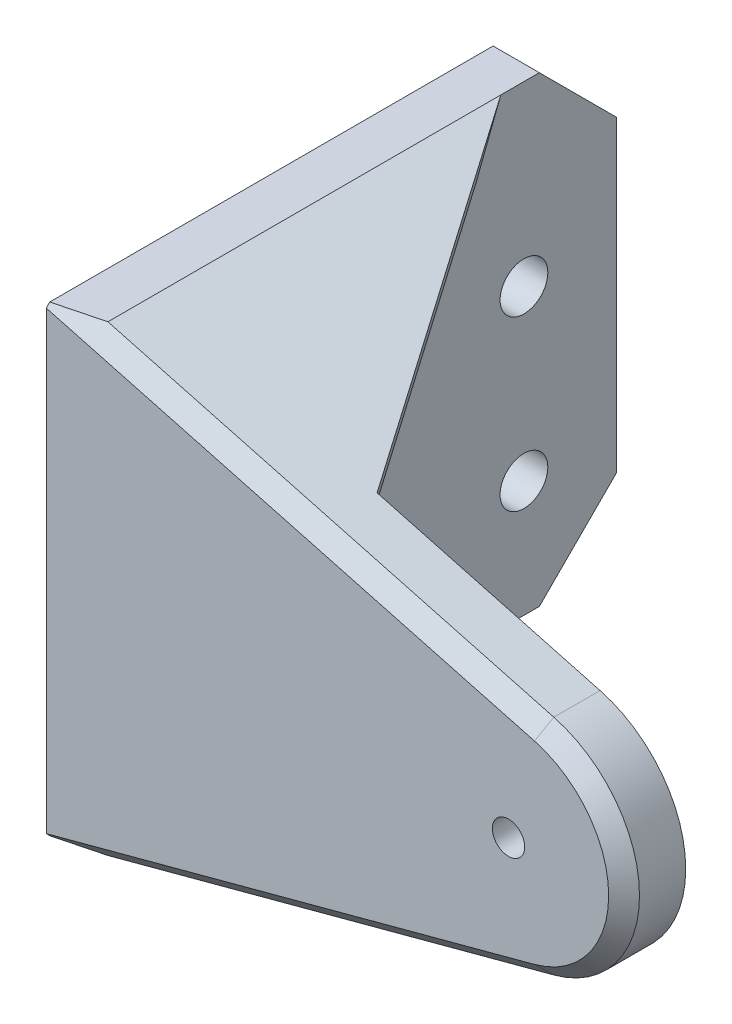
from build123d import *

# Parameters (mm, degrees)
BOSS_EXTRUDE1_DEPTH = 4
SKETCH1_3_R         = 1.984
CUT_EXTRUDE1_DEPTH  = 1
CUT_EXTRUDE2_REACH  = 34.188
SKETCH2_R           = 1.05
SKETCH3_W           = 3
SKETCH3_H           = 30
BOSS_EXTRUDE2_DEPTH = 30
BOSS_EXTRUDE3_DEPTH = 4
CHAMFER1_SIZE       = 5
CHAMFER2_SIZE       = 5
CHAMFER3_SIZE       = 1
CUT_EXTRUDE3_REACH  = 52.128
SKETCH6_R           = 1.55


with BuildPart() as part:
    # Sketch1 → Boss-Extrude1 (new body)
    with BuildSketch(Plane.XY):
        with BuildLine():
            Line((-21.444, -9.44375), (7.49732978, -1.688143604))
            ThreePointArc((7.49732978, -1.688143604), (13.056, 5.55625), (7.49732978, 12.800643604))
            Line((7.49732978, 12.800643604), (-21.444, 20.55625))
            Line((-21.444, 20.55625), (-24.444, 20.55625))
            Line((-24.444, 20.55625), (-24.444, -9.44375))
            Line((-24.444, -9.44375), (-21.444, -9.44375))
        make_face()
    extrude(amount=BOSS_EXTRUDE1_DEPTH)

    # Sketch1<3> → Cut-Extrude1 (cut)
    with BuildSketch(Plane.XY):
        with Locations((5.556, 5.55625)):
            Circle(SKETCH1_3_R)
    extrude(amount=CUT_EXTRUDE1_DEPTH, mode=Mode.SUBTRACT)

    # Sketch2 → Cut-Extrude2 (cut, up to next)
    with BuildSketch(Plane.XY.offset(4), mode=Mode.PRIVATE) as cut_extrude2_sk1:
        with Locations((5.556, 5.55625)):
            Circle(SKETCH2_R)
    cut_extrude2_tool1 = extrude(cut_extrude2_sk1.sketch, amount=-CUT_EXTRUDE2_REACH, mode=Mode.PRIVATE) & part.part
    add(cut_extrude2_tool1.solids().sort_by_distance((5.556, 5.55625, 4))[0], mode=Mode.SUBTRACT)

    # Sketch3 → Boss-Extrude2 (add)
    with BuildSketch(Plane(origin=(0, 0, 0), x_dir=(-1, 0, 0), z_dir=(0, 0, -1))):
        with Locations((22.944, 5.55625)):
            Rectangle(SKETCH3_W, SKETCH3_H)
    extrude(amount=BOSS_EXTRUDE2_DEPTH)

    # Sketch4 → Boss-Extrude3 (add)
    with BuildSketch(Plane(origin=(3.702769565, 13.817497898, 0), x_dir=(0.9659191471648285, -0.25884397064712666, 0), z_dir=(0.25884397064712666, 0.9659191471648285, 0))):
        Polygon((-26.034031563, 22.5), (-11.052793297, 0), (-11.052793297, -0.5), (-26.034031563, -0.5), align=None)
    extrude(amount=-BOSS_EXTRUDE3_DEPTH)

    # Chamfer1
    chamfer1_edges = [part.edges().sort_by_distance(p)[0] for p in [
        (-21.444, 3.485683322, 0),
    ]]
    chamfer(chamfer1_edges, length=CHAMFER1_SIZE)

    # Chamfer2
    chamfer2_edges = [part.edges().sort_by_distance(p)[0] for p in [
        (-22.944, -9.44375, -30),
        (-22.944, 20.55625, -30),
    ]]
    chamfer(chamfer2_edges, length=CHAMFER2_SIZE)

    # Chamfer3
    chamfer3_edges = [part.edges().sort_by_distance(p)[0] for p in [
        (-6.97333511, -5.565946802, 4),
        (13.056, 5.55625, 4),
        (-6.97333511, 16.678446802, 4),
    ]]
    chamfer(chamfer3_edges, length=CHAMFER3_SIZE)

    # Sketch6 → Cut-Extrude3 (cut, up to next)
    with BuildSketch(Plane(origin=(-21.444, 0, 0), x_dir=(0, 0, -1), z_dir=(1, 0, 0)), mode=Mode.PRIVATE) as cut_extrude3_sk1:
        with Locations((11, 9.04722098)):
            Circle(SKETCH6_R)
    cut_extrude3_tool1 = extrude(cut_extrude3_sk1.sketch, amount=-CUT_EXTRUDE3_REACH, mode=Mode.PRIVATE) & part.part
    # Sketch6 → Cut-Extrude3 (cut, up to next)
    with BuildSketch(Plane(origin=(-21.444, 0, 0), x_dir=(0, 0, -1), z_dir=(1, 0, 0)), mode=Mode.PRIVATE) as cut_extrude3_sk2:
        with Locations((24, 9.04722098)):
            Circle(SKETCH6_R)
    cut_extrude3_tool2 = extrude(cut_extrude3_sk2.sketch, amount=-CUT_EXTRUDE3_REACH, mode=Mode.PRIVATE) & part.part
    # Sketch6 → Cut-Extrude3 (cut, up to next)
    with BuildSketch(Plane(origin=(-21.444, 0, 0), x_dir=(0, 0, -1), z_dir=(1, 0, 0)), mode=Mode.PRIVATE) as cut_extrude3_sk3:
        with Locations((11, -1.889802378)):
            Circle(SKETCH6_R)
    cut_extrude3_tool3 = extrude(cut_extrude3_sk3.sketch, amount=-CUT_EXTRUDE3_REACH, mode=Mode.PRIVATE) & part.part
    # Sketch6 → Cut-Extrude3 (cut, up to next)
    with BuildSketch(Plane(origin=(-21.444, 0, 0), x_dir=(0, 0, -1), z_dir=(1, 0, 0)), mode=Mode.PRIVATE) as cut_extrude3_sk4:
        with Locations((24, -1.889802378)):
            Circle(SKETCH6_R)
    cut_extrude3_tool4 = extrude(cut_extrude3_sk4.sketch, amount=-CUT_EXTRUDE3_REACH, mode=Mode.PRIVATE) & part.part
    add(cut_extrude3_tool1.solids().sort_by_distance((-21.444, 9.047221, -11))[0], mode=Mode.SUBTRACT)
    add(cut_extrude3_tool2.solids().sort_by_distance((-21.444, 9.047221, -24))[0], mode=Mode.SUBTRACT)
    add(cut_extrude3_tool3.solids().sort_by_distance((-21.444, -1.889802, -11))[0], mode=Mode.SUBTRACT)
    add(cut_extrude3_tool4.solids().sort_by_distance((-21.444, -1.889802, -24))[0], mode=Mode.SUBTRACT)


solid = part.part
